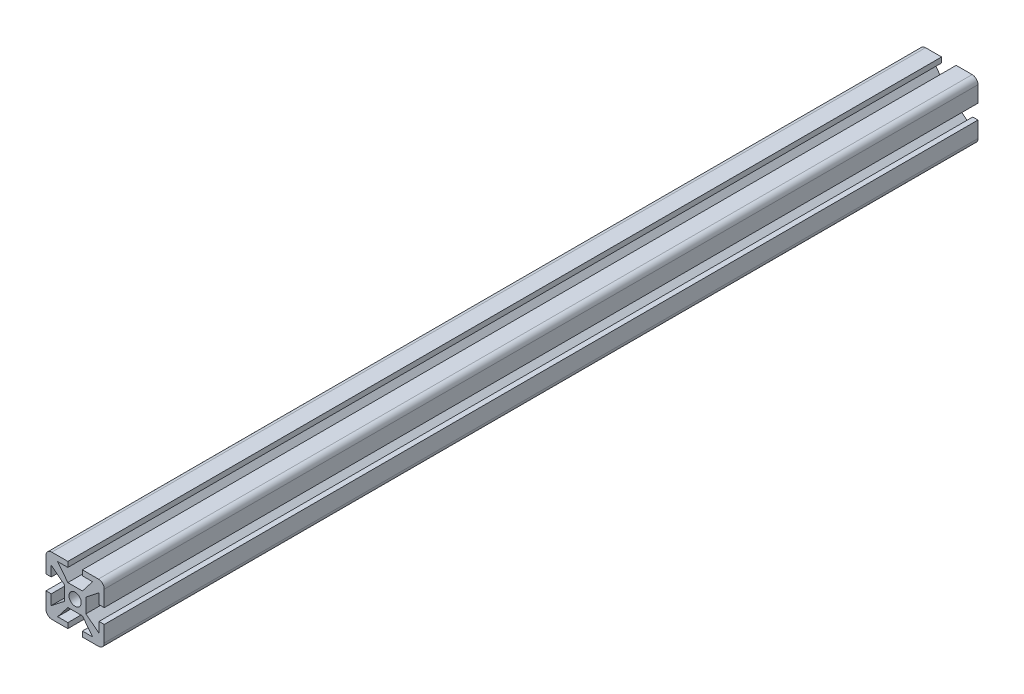
from build123d import *

# Parameters (mm, degrees)
EXTRUSION1_DEPTH        = 300
PER_AGE1_OUTLINE_R      = 2.1
PER_AGE1_DEPTH          = 300
ENL_V_MAT_EXTRU_1_DEPTH = 300
ENL_V_MAT_EXTRU_3_DEPTH = 300
ENL_V_MAT_EXTRU_4_DEPTH = 301.333148354
ENL_V_MAT_EXTRU_7_DEPTH = 301.333148354


# Read off the part's stored shape, not the designer's step: Perçage1
with BuildPart() as part:
    # Esquisse1 → Extrusion1 (new body)
    with BuildSketch(Plane.XY):
        with BuildLine():
            Line((-10, 8), (-10, -8))
            ThreePointArc((-10, -8), (-9.414213562, -9.414213562), (-8, -10))
            Line((-8, -10), (8, -10))
            ThreePointArc((8, -10), (9.414213562, -9.414213562), (10, -8))
            Line((10, -8), (10, 8))
            ThreePointArc((10, 8), (9.414213562, 9.414213562), (8, 10))
            Line((8, 10), (-8, 10))
            ThreePointArc((-8, 10), (-9.414213562, 9.414213562), (-10, 8))
        make_face()
    extrude(amount=EXTRUSION1_DEPTH)

    # Perçage1 outline → Perçage1 (cut)
    with BuildSketch(Plane.XY):
        Circle(PER_AGE1_OUTLINE_R)
    extrude(amount=PER_AGE1_DEPTH, mode=Mode.SUBTRACT)

    # Esquisse3 → Enlèv. mat.-Extru.1 (cut)
    with BuildSketch(Plane.XY.offset(300)):
        Polygon((10, 2.5), (8.2, 2.5), (8.2, 6), (3.7, 2.5), (3.7, -2.5), (8.2, -6), (8.2, -2.5), (10, -2.5), align=None)
    extrude(amount=-ENL_V_MAT_EXTRU_1_DEPTH, mode=Mode.SUBTRACT)

    # Esquisse5 → Enlèv. mat.-Extru.3 (cut)
    with BuildSketch(Plane.XY.offset(300)):
        Polygon((-2.5, 10), (-2.5, 8.2), (-6, 8.2), (-2.5, 3.7), (2.5, 3.7), (6, 8.2), (2.5, 8.2), (2.5, 10), align=None)
    extrude(amount=-ENL_V_MAT_EXTRU_3_DEPTH, mode=Mode.SUBTRACT)

    # Esquisse6 → Enlèv. mat.-Extru.4 (cut, through all)
    with BuildSketch(Plane.XY.offset(300)):
        Polygon((-2.5, -10), (-2.5, -8.2), (-6, -8.2), (-2.5, -3.7), (2.5, -3.7), (6, -8.2), (2.5, -8.2), (2.5, -10), align=None)
    extrude(amount=-ENL_V_MAT_EXTRU_4_DEPTH, mode=Mode.SUBTRACT)

    # Esquisse4 → Enlèv. mat.-Extru.7 (cut, through all)
    with BuildSketch(Plane.XY.offset(300)):
        Polygon((-10, 2.5), (-8.2, 2.5), (-8.2, 6), (-3.7, 2.5), (-3.7, -2.5), (-8.2, -6), (-8.2, -2.5), (-10, -2.5), align=None)
    extrude(amount=-ENL_V_MAT_EXTRU_7_DEPTH, mode=Mode.SUBTRACT)


solid = part.part
